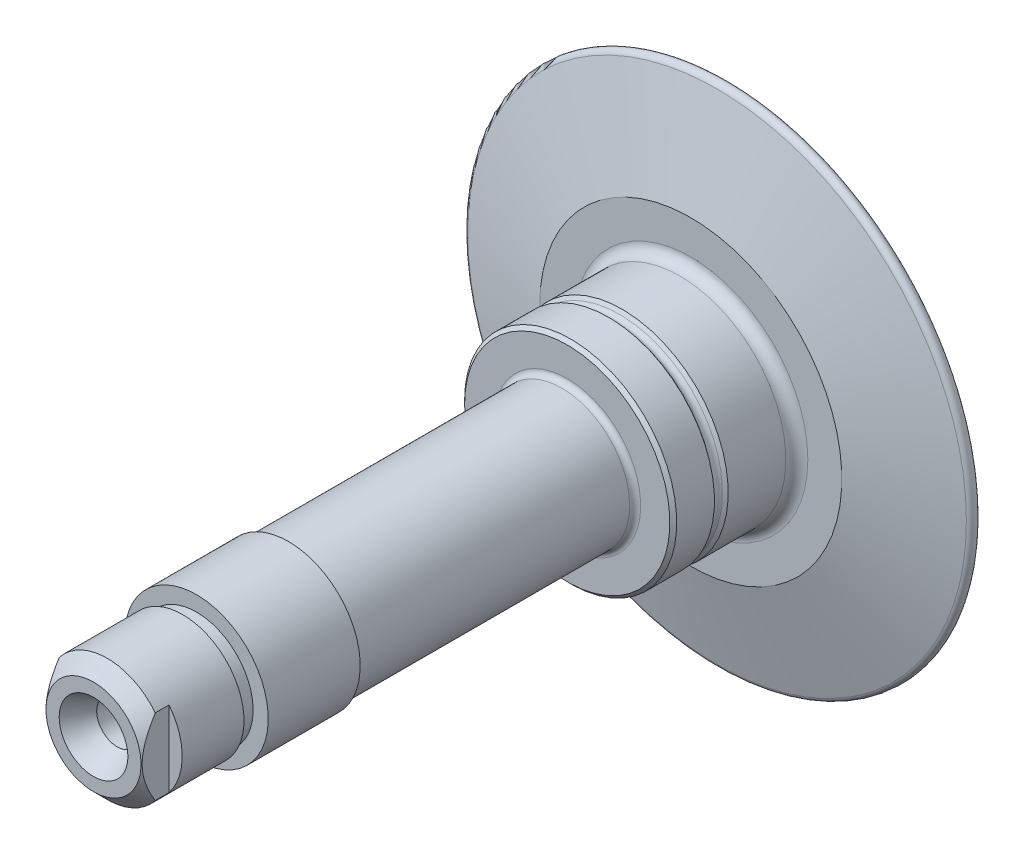
from build123d import *

# Parameters (mm, degrees)
SKETCH2_W          = 5.640914366
SKETCH2_H          = 12.238248986
CUT_EXTRUDE1_DEPTH = 2


with BuildPart() as part:
    # Sketch1 → Revolve1 (revolve)
    with BuildSketch(Plane(origin=(0, 0, 0), x_dir=(0, 0, -1), z_dir=(1, 0, 0))):
        with BuildLine():
            Line((-14.25, 7.725), (-11.5, 7.725))
            Line((-11.5, 7.725), (-11.317341336, 7.486954595))
            ThreePointArc((-11.317341336, 7.486954595), (-11, 7.330459166), (-10.682658664, 7.486954595))
            Line((-10.682658664, 7.486954595), (-10.5, 7.725))
            Line((-10.5, 7.725), (-6.3, 7.725))
            ThreePointArc((-6.3, 7.725), (-5.734314575, 7.959314575), (-5.5, 8.525))
            Line((-5.5, 8.525), (-5.5, 11))
            Line((-5.5, 11), (-3.582937415, 18.154574968))
            ThreePointArc((-3.582937415, 18.154574968), (-3.207079201, 18.449895027), (-2.818065836, 18.172132655))
            ThreePointArc((-2.818065836, 18.172132655), (-0.708701946, 9.194671015), (0, 0))
            Line((0, 0), (-43.267949192, 0))
            Line((-43.267949192, 0), (-44.169240121, 1.5))
            Line((-44.169240121, 1.5), (-47.267949192, 1.5))
            Line((-47.267949192, 1.5), (-49, 2.5))
            Line((-49, 2.5), (-49, 3.46))
            Line((-49, 3.46), (-48, 4.46))
            Line((-48, 4.46), (-42.5, 4.46))
            Line((-42.5, 4.46), (-42.5, 4.125))
            Line((-42.5, 4.125), (-41.5, 4.125))
            Line((-41.5, 4.125), (-41.5, 5.225))
            Line((-41.5, 5.225), (-34.8, 5.225))
            Line((-34.8, 5.225), (-34.8, 4.95))
            Line((-34.8, 4.95), (-14.9, 4.95))
            ThreePointArc((-14.9, 4.95), (-14.617157288, 5.067157288), (-14.5, 5.35))
            Line((-14.5, 5.35), (-14.5, 7.475))
            Line((-14.5, 7.475), (-14.25, 7.725))
        make_face()
    revolve(axis=Axis((0, 0, 0), (0, 0, 1)))

    # Sketch2 → Cut-Extrude1 (cut)
    with BuildSketch(Plane.XY.offset(49)):
        with Locations((6.320457183, 0)):
            Rectangle(SKETCH2_W, SKETCH2_H)
        with Locations((-6.320457183, 0)):
            Rectangle(SKETCH2_W, SKETCH2_H)
    extrude(amount=-CUT_EXTRUDE1_DEPTH, mode=Mode.SUBTRACT)


solid = part.part
